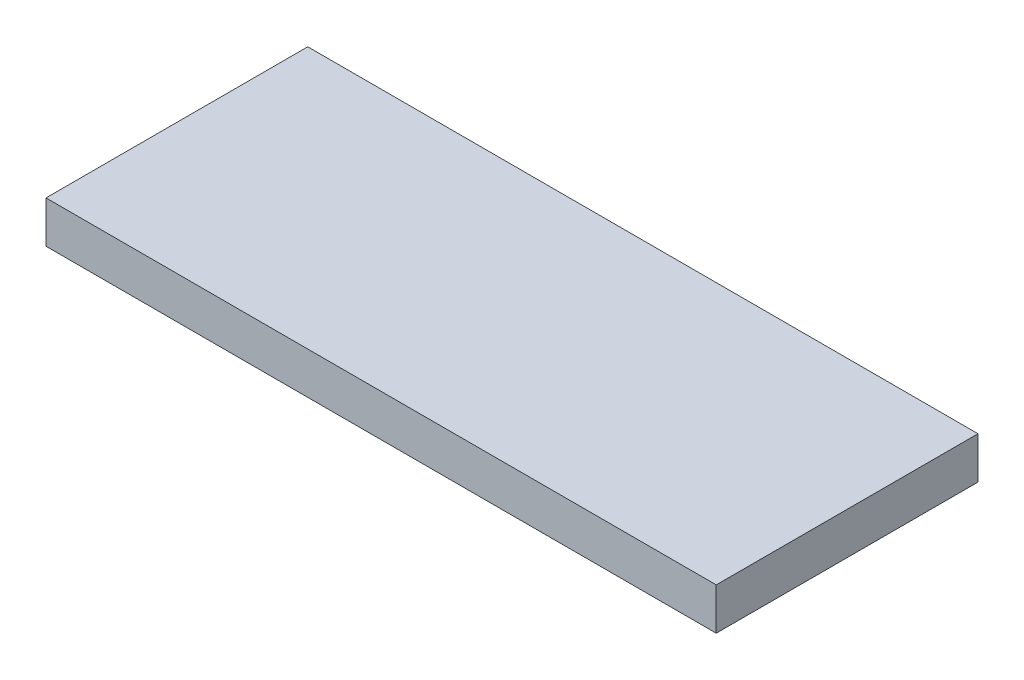
from build123d import *

# Parameters (mm, degrees)
SKETCH1_W           = 32.007575758
SKETCH1_H           = 12.5
BOSS_EXTRUDE1_DEPTH = 2


with BuildPart() as part:
    # Sketch1 → Boss-Extrude1 (new body)
    with BuildSketch(Plane(origin=(0, 0, 0), x_dir=(1, 0, 0), z_dir=(0, 1, 0))):
        with Locations((16.003787879, 6.25)):
            Rectangle(SKETCH1_W, SKETCH1_H)
    extrude(amount=BOSS_EXTRUDE1_DEPTH)


solid = part.part
